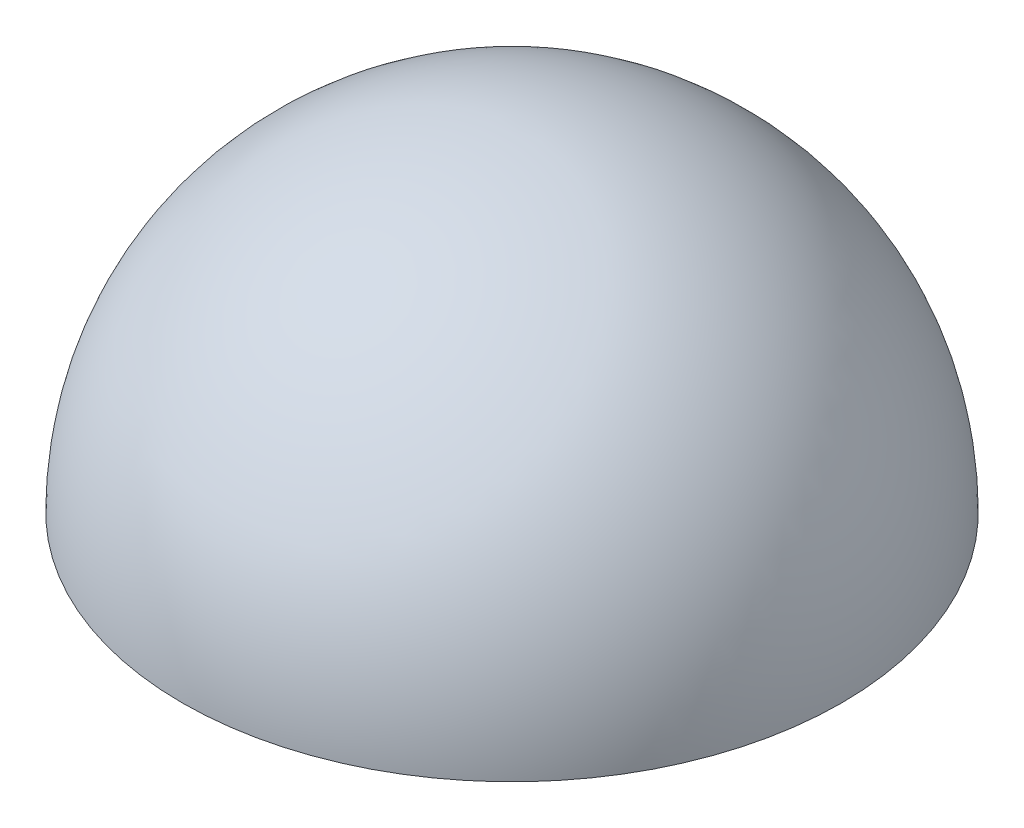
from build123d import *

# Parameters (mm, degrees)
CUT_EXTRUDE2_DEPTH = 3.5
CUT_EXTRUDE4_DEPTH = 2
SKETCH7_R          = 1.5
CUT_EXTRUDE6_DEPTH = 7
CUT_EXTRUDE7_DEPTH = 2.2


with BuildPart() as part:
    # Sketch1 → Revolve1 (revolve)
    with BuildSketch(Plane.XY):
        with BuildLine():
            ThreePointArc((0, 15), (-10.606601718, 10.606601718), (-15, 0))
            Line((-15, 0), (0, 0))
            Line((0, 0), (0, 15))
        make_face()
    revolve(axis=Axis((0, -1000, 0), (0, 1, 0)))

    # Sketch2 → Cut-Extrude2 (cut)
    with BuildSketch(Plane.XZ):
        Polygon((4.878609775, -8.45), (9.757219549, 0), (4.878609775, 8.45), (-4.878609775, 8.45), (-9.757219549, 0), (-4.878609775, -8.45), align=None)
    extrude(amount=-CUT_EXTRUDE2_DEPTH, mode=Mode.SUBTRACT)

    # Sketch3 → Cut-Extrude4 (cut)
    with BuildSketch(Plane.XZ.offset(-3.5)):
        Polygon((3.723909236, -6.45), (7.447818473, 0), (3.723909236, 6.45), (-3.723909236, 6.45), (-7.447818473, 0), (-3.723909236, -6.45), align=None)
    extrude(amount=-CUT_EXTRUDE4_DEPTH, mode=Mode.SUBTRACT)

    # Sketch4 → Cut-Revolve1 (revolve, cut)
    with BuildSketch(Plane(origin=(0, 0, 0), x_dir=(0, 0, -1), z_dir=(1, 0, 0))):
        with BuildLine():
            Line((-6.45, 5.5), (0, 5.5))
            Line((0, 5.5), (0, 13.5))
            add(Edge.make_bspline(
                [(0, 13.5), (-6.45, 13.5), (-6.45, 5.5)],
                knots=[0, 0, 0, 1.570796327, 1.570796327, 1.570796327], degree=2, weights=[1, 0.707106781, 1]))
        make_face()
    revolve(axis=Axis((0, -1000, 0), (0, 1, 0)), mode=Mode.SUBTRACT)

    # Sketch7 → Cut-Extrude6 (cut)
    with BuildSketch(Plane.XZ):
        with Locations((-9.959292144, 5.75)):
            Circle(SKETCH7_R)
        with Locations((9.959292144, 5.75)):
            Circle(SKETCH7_R)
        with Locations((0, -11.5)):
            Circle(SKETCH7_R)
    extrude(amount=-CUT_EXTRUDE6_DEPTH, mode=Mode.SUBTRACT)

    # Sketch8 → Cut-Extrude7 (cut)
    with BuildSketch(Plane.XZ):
        Polygon((-8.42931393, 3.1), (-6.899335717, 5.75), (-8.42931393, 8.4), (-11.489270357, 8.4), (-13.01924857, 5.75), (-11.489270357, 3.1), align=None)
        Polygon((6.899335717, 5.75), (8.42931393, 3.1), (11.489270357, 3.1), (13.01924857, 5.75), (11.489270357, 8.4), (8.42931393, 8.4), align=None)
        Polygon((1.529978213, -8.85), (-1.529978213, -8.85), (-3.059956427, -11.5), (-1.529978213, -14.15), (1.529978213, -14.15), (3.059956427, -11.5), align=None)
    extrude(amount=-CUT_EXTRUDE7_DEPTH, mode=Mode.SUBTRACT)


solid = part.part
